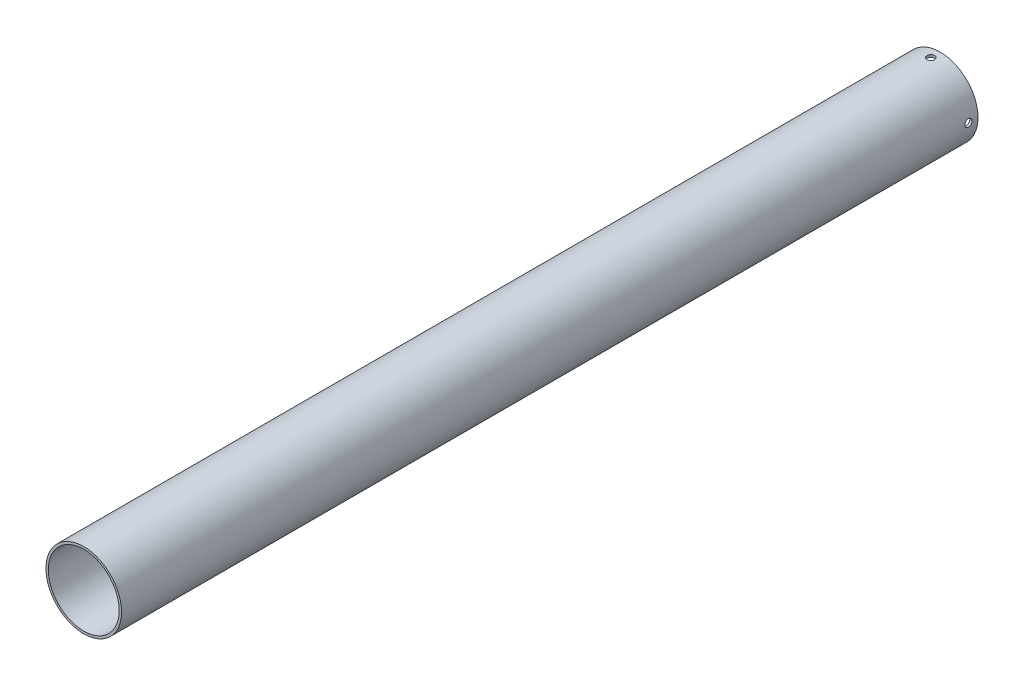
from build123d import *

# Parameters (mm, degrees)
SKETCH1_R               = 25.4
SKETCH1_R_2             = 23.8125
BOSS_EXTRUDE1_DEPTH     = 287.606496287
CUT_EXTRUDE1_DEPTH      = 290.84101971
CUT_EXTRUDE1_DEPTH_BACK = 290.84101971
SKETCH2_R               = 2.4892
CUT_EXTRUDE2_DEPTH      = 290.841019827
CUT_EXTRUDE2_DEPTH_BACK = 290.841019827
SKETCH3_R               = 2.4892


with BuildPart() as part:
    # Sketch1 → Boss-Extrude1 (new, symmetric)
    with BuildSketch(Plane.XY):
        Circle(SKETCH1_R)
        Circle(SKETCH1_R_2, mode=Mode.SUBTRACT)
    extrude(amount=BOSS_EXTRUDE1_DEPTH, both=True)

    # Sketch2 → Cut-Extrude1 (cut, two sides: drawn at the far end of the back side and taken through both)
    with BuildSketch(Plane(origin=(0, 0, 0), x_dir=(0, 0, -1), z_dir=(1, 0, 0)).offset(-CUT_EXTRUDE1_DEPTH_BACK)):
        with Locations((281.256496287, 0)):
            Circle(SKETCH2_R)
    extrude(amount=CUT_EXTRUDE1_DEPTH + CUT_EXTRUDE1_DEPTH_BACK, mode=Mode.SUBTRACT)

    # Sketch3 → Cut-Extrude2 (cut, two sides: drawn at the far end of the back side and taken through both)
    with BuildSketch(Plane(origin=(0, 0, 0), x_dir=(1, 0, 0), z_dir=(0, 1, 0)).offset(-CUT_EXTRUDE2_DEPTH_BACK)):
        with Locations((0, 281.256496287)):
            Circle(SKETCH3_R)
    extrude(amount=CUT_EXTRUDE2_DEPTH + CUT_EXTRUDE2_DEPTH_BACK, mode=Mode.SUBTRACT)


solid = part.part
